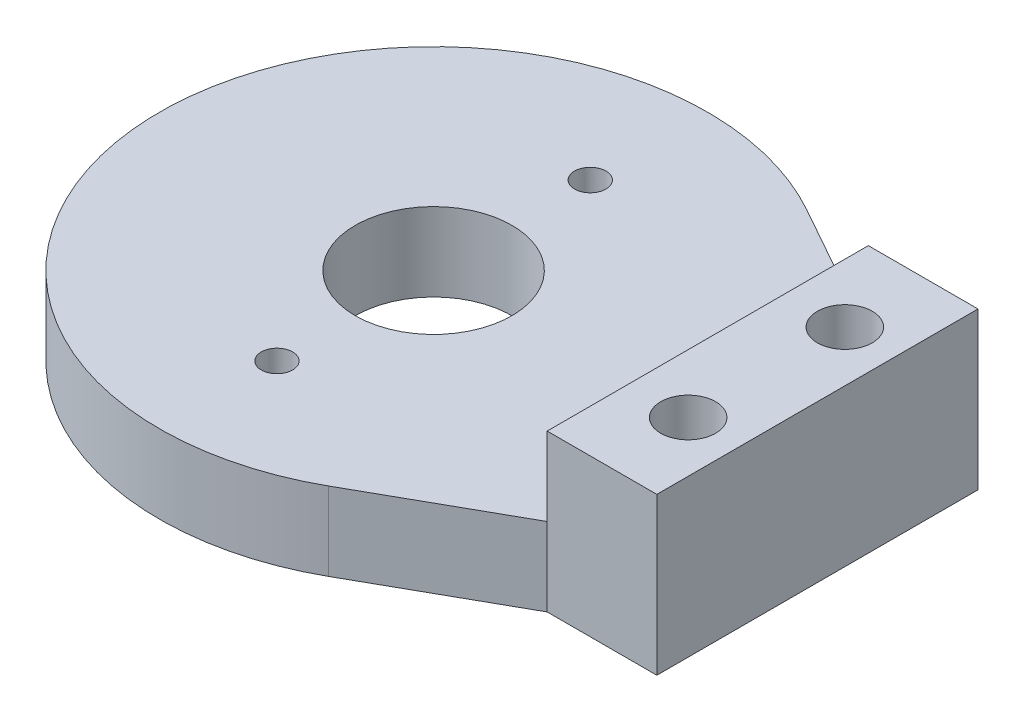
from build123d import *

# Parameters (mm, degrees)
SKETCH1_W               = 7
SKETCH1_H               = 20.5
MOUNTINGBASE_DEPTH      = 10
SKETCH2_R               = 1.75
MOUNTINGHOLES_DEPTH     = 10
HORNTAB_DEPTH           = 5
SKETCH4_R               = 1
SKETCH4_R_2             = 5
HORNMOUNTINGHOLES_DEPTH = 5


with BuildPart() as part:
    # Sketch1 → mountingBase (new body)
    with BuildSketch(Plane(origin=(0, 0, 0), x_dir=(1, 0, 0), z_dir=(0, 1, 0))):
        with Locations((3.5, -10.25)):
            Rectangle(SKETCH1_W, SKETCH1_H)
    extrude(amount=MOUNTINGBASE_DEPTH)

    # Sketch2 → mountingHoles (cut)
    with BuildSketch(Plane(origin=(0, 10, 0), x_dir=(1, 0, 0), z_dir=(0, 1, 0))):
        with Locations((3.75, -5.25)):
            Circle(SKETCH2_R)
        with Locations((3.75, -15.25)):
            Circle(SKETCH2_R)
    extrude(amount=-MOUNTINGHOLES_DEPTH, mode=Mode.SUBTRACT)

    # Sketch3 → hornTab (add)
    with BuildSketch(Plane(origin=(0, 0, 0), x_dir=(1, 0, 0), z_dir=(0, 1, 0))):
        with BuildLine():
            Line((0, 0), (-8.940130679, 5.013637745))
            ThreePointArc((-8.940130679, 5.013637745), (-35, -10.25), (-8.940130679, -25.513637745))
            Line((-8.940130679, -25.513637745), (0, -20.5))
            Line((0, -20.5), (0, 0))
        make_face()
    extrude(amount=HORNTAB_DEPTH)

    # Sketch4 → hornMountingHoles (cut)
    with BuildSketch(Plane(origin=(0, 5, 0), x_dir=(1, 0, 0), z_dir=(0, 1, 0))):
        with Locations((-17.5, -0.25)):
            Circle(SKETCH4_R)
        with Locations((-17.5, -20.25)):
            Circle(SKETCH4_R)
        with Locations((-17.5, -10.25)):
            Circle(SKETCH4_R_2)
    extrude(amount=-HORNMOUNTINGHOLES_DEPTH, mode=Mode.SUBTRACT)


solid = part.part
